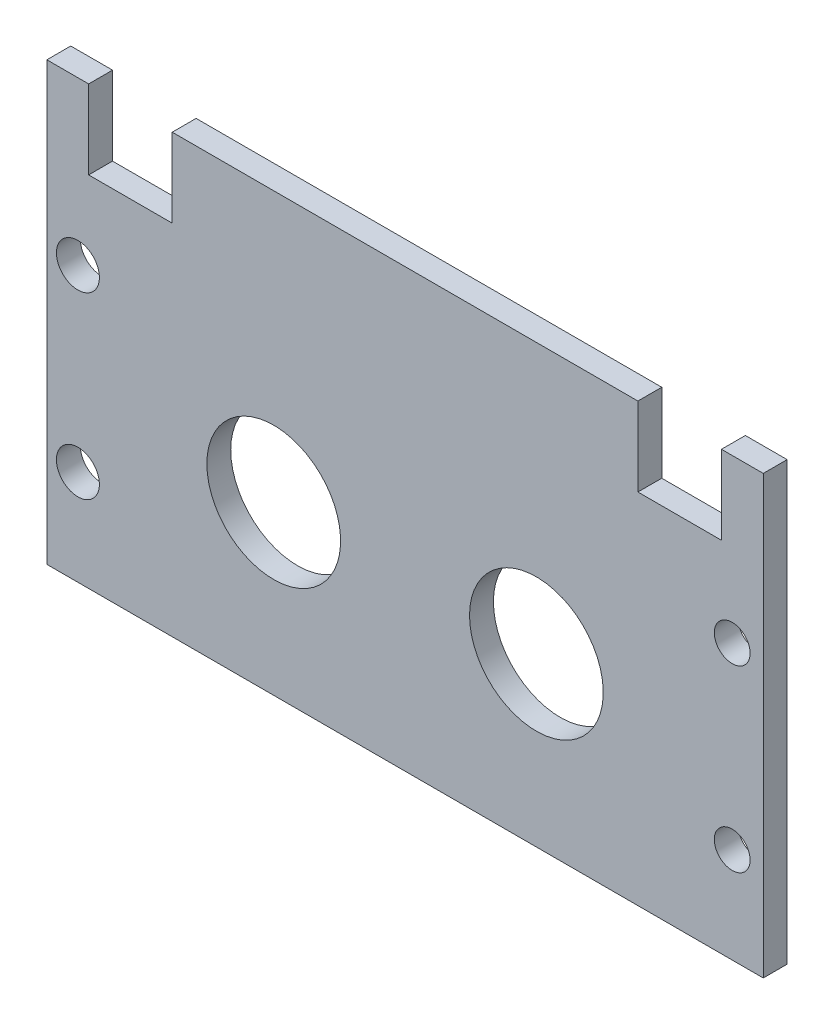
from build123d import *

# Parameters (mm, degrees)
IZIM1_W               = 300
IZIM1_H               = 150
TABAN_FLAN_1_DEPTH    = 10
IZIM2_R               = 28
KES_EKSTR_ZYON1_DEPTH = 10
IZIM3_R               = 7.5
KES_EKSTR_ZYON2_DEPTH = 10
IZIM4_R               = 7.5
KES_EKSTR_ZYON3_DEPTH = 10
IZIM5_R               = 9
KES_EKSTR_ZYON4_DEPTH = 169.002976164
IZIM8_W               = 17.5
IZIM8_H               = 33
IZIM8_W_2             = 195
SEKME1_DEPTH          = 10


# Sheet-metal steps are written as plain solids
with BuildPart() as part:
    # Çizim1 → Taban-Flanş1 (new body)
    with BuildSketch(Plane.XY):
        Rectangle(IZIM1_W, IZIM1_H)
    extrude(amount=-TABAN_FLAN_1_DEPTH)

    # Çizim2 → Kes-Ekstrüzyon1 (cut)
    with BuildSketch(Plane(origin=(0, 0, -10), x_dir=(-1, 0, 0), z_dir=(0, 0, -1))):
        with Locations((-55, -5)):
            Circle(IZIM2_R)
        with Locations((55, -5)):
            Circle(IZIM2_R)
    extrude(amount=-KES_EKSTR_ZYON1_DEPTH, mode=Mode.SUBTRACT)

    # Çizim3 → Kes-Ekstrüzyon2 (cut)
    with BuildSketch(Plane(origin=(0, 0, -10), x_dir=(-1, 0, 0), z_dir=(0, 0, -1))):
        with Locations((-137, -35)):
            Circle(IZIM3_R)
        with Locations((-137, 40)):
            Circle(IZIM3_R)
    extrude(amount=-KES_EKSTR_ZYON2_DEPTH, mode=Mode.SUBTRACT)

    # Çizim4 → Kes-Ekstrüzyon3 (cut)
    with BuildSketch(Plane(origin=(0, 0, -10), x_dir=(-1, 0, 0), z_dir=(0, 0, -1))):
        with Locations((137, -35)):
            Circle(IZIM4_R)
        with Locations((137, 40)):
            Circle(IZIM4_R)
    extrude(amount=-KES_EKSTR_ZYON3_DEPTH, mode=Mode.SUBTRACT)

    # Çizim5 → Kes-Ekstrüzyon4 (cut, through all)
    with BuildSketch(Plane(origin=(0, 0, -10), x_dir=(-1, 0, 0), z_dir=(0, 0, -1))):
        with Locations((137, -35)):
            Circle(IZIM5_R)
        with Locations((137, 40)):
            Circle(IZIM5_R)
    extrude(amount=-KES_EKSTR_ZYON4_DEPTH, mode=Mode.SUBTRACT)

    # Çizim8 → Sekme1 (add)
    with BuildSketch(Plane(origin=(0, 0, -10), x_dir=(-1, 0, 0), z_dir=(0, 0, -1))):
        with Locations((141.25, 91.5)):
            Rectangle(IZIM8_W, IZIM8_H)
        with Locations((0, 91.5)):
            Rectangle(IZIM8_W_2, IZIM8_H)
        with Locations((-141.25, 91.5)):
            Rectangle(IZIM8_W, IZIM8_H)
    extrude(amount=-SEKME1_DEPTH)


solid = part.part
